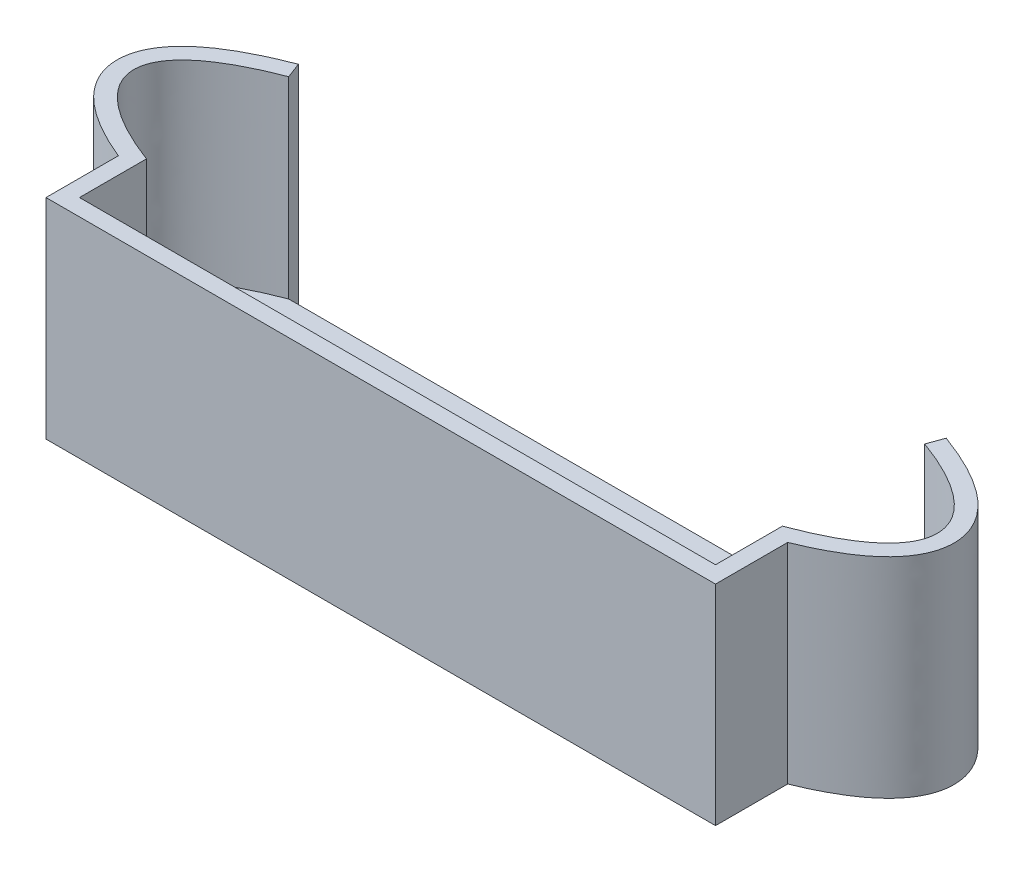
from build123d import *

# Parameters (mm, degrees)
EXTRUDE_THIN1_DEPTH = 25
SKETCH1_4_W         = 5
SKETCH1_4_H         = 8
BOSS_EXTRUDE1_DEPTH = 2


# Read off the part's stored shape, not the designer's step: Extrude-Thin1
with BuildPart() as part:
    # Extrude-Thin1 outline → Extrude-Thin1 (new body)
    with BuildSketch(Plane(origin=(0, 0, 0), x_dir=(1, 0, 0), z_dir=(0, 1, 0))):
        with BuildLine():
            Line((-38, -16.5), (-38, -8.5))
            add(Edge.make_bspline(
                [(-38, -8.5), (-44.097173442, -6.191975733), (-51.24911635, -0.338068019), (-45.404593858, 5.680809666), (-38, 8.5)],
                knots=[0, 0, 0, 0, 0.45, 1, 1, 1, 1], degree=3))
            Line((-38, 8.5), (-38.711636331, 10.369110412))
            add(Edge.make_bspline(
                [(-40, -9.859841794), (-41.606386453, -9.196458265), (-43.017472016, -8.501725084), (-45.469707437, -7.035602306), (-46.512220325, -6.264852114), (-47.804314217, -5.016726081), (-48.189528627, -4.584904063), (-48.861828962, -3.681646539), (-49.148945908, -3.209825558), (-49.608266758, -2.224452325), (-49.779923805, -1.710805438), (-49.987416601, -0.657795935), (-50.022684998, -0.117692843), (-49.948308777, 0.954692848), (-49.838948343, 1.485949966), (-49.492254198, 2.510170013), (-49.255698689, 3.003157429), (-48.677599503, 3.945189967), (-48.336215051, 4.394726597), (-47.560818188, 5.257811894), (-47.12665517, 5.671599025), (-45.690080991, 6.872176624), (-44.553820309, 7.619607901), (-41.913701573, 9.045316851), (-40.409063551, 9.722839934), (-38.711636331, 10.369110412)],
                knots=[0, 0, 0, 0, 0.125, 0.125, 0.25, 0.25, 0.3125, 0.3125, 0.375, 0.375, 0.4375, 0.4375, 0.5, 0.5, 0.5625, 0.5625, 0.625, 0.625, 0.6875, 0.6875, 0.75, 0.75, 0.875, 0.875, 1, 1, 1, 1], degree=3))
            Line((-40, -9.859841794), (-40, -18.5))
            Line((-40, -18.5), (40, -18.5))
            Line((40, -18.5), (40, -9.873686568))
            add(Edge.make_bspline(
                [(38.684040287, 10.379385242), (40.404146523, 9.753317772), (41.922997097, 9.088004701), (44.580778609, 7.67329588), (45.720598061, 6.924508695), (47.156908421, 5.714585478), (47.590001398, 5.296481601), (48.361311267, 4.423750332), (48.699629675, 3.968883794), (49.270210276, 3.017732284), (49.502265384, 2.521057808), (49.841478111, 1.493563088), (49.948317052, 0.963257165), (50.022307254, -0.110491836), (49.98871569, -0.652606556), (49.783918004, -1.713702721), (49.613332553, -2.232123006), (49.155378033, -3.226795657), (48.868494073, -3.703362334), (48.19572387, -4.615356392), (47.809819507, -5.05115076), (46.514967687, -6.308605239), (45.469763356, -7.082043918), (43.014746143, -8.541621876), (41.603565288, -9.227195017), (40, -9.873686568)],
                knots=[0, 0, 0, 0, 0.125, 0.125, 0.25, 0.25, 0.3125, 0.3125, 0.375, 0.375, 0.4375, 0.4375, 0.5, 0.5, 0.5625, 0.5625, 0.625, 0.625, 0.6875, 0.6875, 0.75, 0.75, 0.875, 0.875, 1, 1, 1, 1], degree=3))
            Line((38.684040287, 10.379385242), (38, 8.5))
            add(Edge.make_bspline(
                [(38, 8.5), (44.126226569, 6.270235881), (51.223936974, 0.356097076), (45.425899484, -5.777606597), (38, -8.5)],
                knots=[0, 0, 0, 0, 0.45, 1, 1, 1, 1], degree=3))
            Line((38, -8.5), (38, -16.5))
            Line((38, -16.5), (-38, -16.5))
        make_face()
    extrude(amount=EXTRUDE_THIN1_DEPTH)

    # Sketch1<4> → Boss-Extrude1 (add)
    with BuildSketch(Plane(origin=(0, 0, 0), x_dir=(1, 0, 0), z_dir=(0, 1, 0))):
        with BuildLine():
            add(Edge.make_bspline(
                [(38, 8.5), (44.126226569, 6.270235881), (51.223936974, 0.356097076), (45.425899484, -5.777606597), (38, -8.5)],
                knots=[0, 0, 0, 0, 0.45, 1, 1, 1, 1], degree=3))
            Line((38, -8.5), (-38, -8.5))
            add(Edge.make_bspline(
                [(-38, 8.5), (-45.404593858, 5.680809666), (-51.24911635, -0.338068019), (-44.097173442, -6.191975733), (-38, -8.5)],
                knots=[0, 0, 0, 0, 0.55, 1, 1, 1, 1], degree=3))
            Line((-38, 8.5), (38, 8.5))
        make_face()
        with Locations((-0.057660248, -12.5)):
            Rectangle(SKETCH1_4_W, SKETCH1_4_H)
    extrude(amount=BOSS_EXTRUDE1_DEPTH)


solid = part.part
